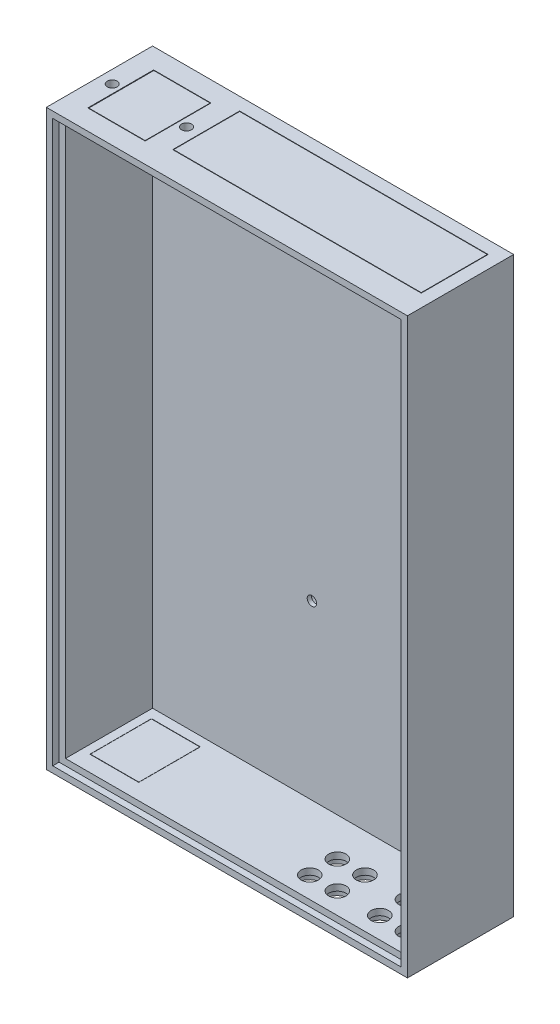
from build123d import *

# Parameters (mm, degrees)
SKETCH1_W           = 170
SKETCH1_H           = 270
BOSS_EXTRUDE1_DEPTH = 50
SKETCH2_W           = 158
SKETCH2_H           = 258
CUT_EXTRUDE1_DEPTH  = 44
SKETCH3_W           = 23
SKETCH3_H           = 29
CUT_EXTRUDE2_DEPTH  = 6
SKETCH4_W           = 28
SKETCH4_H           = 35
CUT_EXTRUDE3_DEPTH  = 4.5
CHAMFER1_SIZE       = 5
CHAMFER2_SIZE       = 5
SKETCH5_W           = 22.8
SKETCH5_H           = 28.7
BOSS_EXTRUDE2_DEPTH = 1.5
SKETCH6_W           = 0.854807692
SKETCH6_H           = 4.7625
CUT_EXTRUDE4_DEPTH  = 0.25
CUT_EXTRUDE5_DEPTH  = 0.25
CUT_EXTRUDE6_DEPTH  = 0.25
SKETCH9_W           = 117
SKETCH9_H           = 31.5
CUT_EXTRUDE7_DEPTH  = 6
SKETCH10_W          = 27
SKETCH10_H          = 31
CUT_EXTRUDE8_DEPTH  = 6
SKETCH11_R          = 2.35
CUT_EXTRUDE9_DEPTH  = 6
SKETCH12_R          = 2.35
CUT_EXTRUDE10_DEPTH = 6
SKETCH13_W          = 116.6
SKETCH13_H          = 31.1
BOSS_EXTRUDE3_DEPTH = 6
SKETCH14_W          = 26.5
SKETCH14_H          = 30.6
BOSS_EXTRUDE4_DEPTH = 6
SKETCH15_R          = 4.1
CUT_EXTRUDE11_DEPTH = 6
SKETCH16_R          = 5.75
CUT_EXTRUDE12_DEPTH = 3
CUT_EXTRUDE13_DEPTH = 0.25
SKETCH18_W          = 2.289663461
SKETCH18_H          = 1.102430555
CUT_EXTRUDE14_DEPTH = 0.25
SKETCH19_R          = 2.2
CUT_EXTRUDE15_DEPTH = 10
SKETCH20_R          = 3.75
CUT_EXTRUDE16_DEPTH = 4
SKETCH21_W          = 164
SKETCH21_H          = 264
CUT_EXTRUDE17_DEPTH = 3


with BuildPart() as part:
    # Sketch1 → Boss-Extrude1 (new body)
    with BuildSketch(Plane.XY):
        with Locations((42.589098532, -74.769392034)):
            Rectangle(SKETCH1_W, SKETCH1_H)
    extrude(amount=BOSS_EXTRUDE1_DEPTH)

    # Sketch2 → Cut-Extrude1 (cut)
    with BuildSketch(Plane.XY.offset(50)):
        with Locations((42.589098532, -74.769392034)):
            Rectangle(SKETCH2_W, SKETCH2_H)
    extrude(amount=-CUT_EXTRUDE1_DEPTH, mode=Mode.SUBTRACT)

    # Sketch3 → Cut-Extrude2 (cut)
    with BuildSketch(Plane.XZ.offset(209.769392034)):
        with Locations((-20.910901468, 25)):
            Rectangle(SKETCH3_W, SKETCH3_H)
    extrude(amount=-CUT_EXTRUDE2_DEPTH, mode=Mode.SUBTRACT)

    # Sketch4 → Cut-Extrude3 (cut)
    with BuildSketch(Plane.XZ.offset(209.769392034)):
        with Locations((-20.910901468, 25)):
            Rectangle(SKETCH4_W, SKETCH4_H)
    extrude(amount=-CUT_EXTRUDE3_DEPTH, mode=Mode.SUBTRACT)

    # Chamfer1
    # the kernel refuses this chamfer: 5 mm, written as the material it takes off along each edge
    with BuildSketch(Plane(origin=(-34.910901468, -209.769392034, 42.5), x_dir=(0, -0.0274958766105877, 0.9996219169112968), z_dir=(1, 0, 0))) as chamfer1_piece_1_section:
        Polygon((CHAMFER1_SIZE * 0.999621916911, -CHAMFER1_SIZE * 0.0274958766106), (-CHAMFER1_SIZE * 0.0274958766106, -CHAMFER1_SIZE * 0.999621916911), (0, 0), align=None)
    chamfer1_piece_1 = extrude(amount=28, mode=Mode.PRIVATE)
    chamfer1_piece_1 = split(chamfer1_piece_1, bisect_by=Plane(origin=(-20.910901468, -205.269392034, 44.179503735), z_dir=(0, -1, 0)), keep=Keep.TOP, mode=Mode.PRIVATE)
    add(chamfer1_piece_1, mode=Mode.SUBTRACT)

    # Chamfer2
    # the kernel refuses this chamfer: 5 mm, written as the material it takes off along each edge
    with BuildSketch(Plane(origin=(-6.910901468, -209.769392034, 7.5), x_dir=(0, 0.9996219169112968, 0.027495876610586282), z_dir=(-1, 0, 0))) as chamfer2_piece_1_section:
        Polygon((CHAMFER2_SIZE * 0.999621916911, CHAMFER2_SIZE * 0.0274958766106), (-CHAMFER2_SIZE * 0.0274958766106, CHAMFER2_SIZE * 0.999621916911), (0, 0), align=None)
    chamfer2_piece_1 = extrude(amount=28, mode=Mode.PRIVATE)
    chamfer2_piece_1 = split(chamfer2_piece_1, bisect_by=Plane(origin=(-20.910901468, -205.269392034, 5.820496265), z_dir=(0, -1, 0)), keep=Keep.TOP, mode=Mode.PRIVATE)
    add(chamfer2_piece_1, mode=Mode.SUBTRACT)

    # Sketch6 → Cut-Extrude4 (cut)
    with BuildSketch(Plane(origin=(0, -81.134696017, -81.134696017), x_dir=(1, 0, 0), z_dir=(0, -0.7071067811865436, -0.7071067811865515))):
        with Locations((-21.390321893, 178.542117658)):
            Rectangle(SKETCH6_W, SKETCH6_H)
    extrude(amount=-CUT_EXTRUDE4_DEPTH, mode=Mode.SUBTRACT)

    # Sketch7 → Cut-Extrude5 (cut)
    with BuildSketch(Plane(origin=(0, -106.134696017, 106.134696017), x_dir=(1, 0, 0), z_dir=(0, -0.7071067811865438, 0.7071067811865513))):
        with BuildLine():
            add(Edge.make_bspline(
                [(-21.393476353, -141.192692767), (-21.358996153, -141.193204636), (-21.291198867, -141.194211105), (-21.191346227, -141.205111993), (-21.095160527, -141.221580195), (-21.002265476, -141.244547593), (-20.913329743, -141.274944127), (-20.827706036, -141.311328257), (-20.746413523, -141.355608406), (-20.668415467, -141.405625108), (-20.593741911, -141.462251105), (-20.524187582, -141.526807666), (-20.458482271, -141.597809341), (-20.398048255, -141.676329548), (-20.341547205, -141.761654063), (-20.289164774, -141.853796415), (-20.241301963, -141.95320758), (-20.197422342, -142.060066953), (-20.158185047, -142.175976309), (-20.125135522, -142.30226518), (-20.096790024, -142.438962405), (-20.072864424, -142.586408245), (-20.054780537, -142.744798691), (-20.042591634, -142.914028515), (-20.034227031, -143.093771467), (-20.03354437, -143.217073656), (-20.033193651, -143.280420632)],
                knots=[0, 0, 0, 0, 0.879237366, 1.728815576, 2.559023295, 3.367336655, 4.166867292, 4.954216142, 5.737608147, 6.525189134, 7.316157332, 8.124696809, 8.942788509, 9.781158001, 10.649253743, 11.551476218, 12.482711956, 13.461909668, 14.496590415, 15.601789533, 16.789733467, 18.056700938, 19.410929216, 20.8549011, 22.384193279, 24, 24, 24, 24], degree=3))
            add(Edge.make_bspline(
                [(-20.033193651, -143.280420632), (-20.033572684, -143.34456015), (-20.034309138, -143.469182083), (-20.042243915, -143.650569056), (-20.055907975, -143.82102759), (-20.073519201, -143.98054005), (-20.097641764, -144.129022201), (-20.125892638, -144.26685851), (-20.15946384, -144.393999017), (-20.199993599, -144.510157245), (-20.243607615, -144.617204287), (-20.291601352, -144.716421623), (-20.343138286, -144.808077991), (-20.397036315, -144.893556151), (-20.456250328, -144.97033625), (-20.51789821, -145.041029213), (-20.584664222, -145.102942254), (-20.653737256, -145.159266095), (-20.727647737, -145.207941196), (-20.805633445, -145.250511637), (-20.88908473, -145.28504132), (-20.976480417, -145.315073395), (-21.069310184, -145.336633184), (-21.166098977, -145.353740168), (-21.267939524, -145.363194537), (-21.33727667, -145.364367413), (-21.37280578, -145.364968408)],
                knots=[0, 0, 0, 0, 1.643780988, 3.193836972, 4.651895693, 6.025988579, 7.305620092, 8.505800249, 9.631074763, 10.672816429, 11.65661981, 12.592235626, 13.49536222, 14.350718032, 15.179365177, 15.97804903, 16.751647189, 17.51006938, 18.259804725, 19.016521909, 19.783502495, 20.571750527, 21.382245291, 22.22305063, 23.089471752, 24, 24, 24, 24], degree=3))
            add(Edge.make_bspline(
                [(-21.37280578, -145.364968408), (-21.408333932, -145.364355821), (-21.477933057, -145.363155771), (-21.580048991, -145.353810465), (-21.677350716, -145.336563883), (-21.770914916, -145.314907875), (-21.860090396, -145.285107769), (-21.945304752, -145.249544982), (-22.025902759, -145.20724016), (-22.102107579, -145.15845165), (-22.173659028, -145.102504659), (-22.241669015, -145.039997602), (-22.305987098, -144.971088918), (-22.36563484, -144.895006774), (-22.421589097, -144.812766706), (-22.473266355, -144.723429575), (-22.520635559, -144.627125451), (-22.565178424, -144.523720098), (-22.603880536, -144.410987316), (-22.638323618, -144.287920417), (-22.666538486, -144.153493535), (-22.68923077, -144.007749858), (-22.707348276, -143.850998149), (-22.720825619, -143.683162749), (-22.728804469, -143.504165484), (-22.7295332, -143.381131747), (-22.729908394, -143.317786667)],
                knots=[0, 0, 0, 0, 0.917216111, 1.796812873, 2.643793957, 3.46689424, 4.273913431, 5.068098542, 5.848489301, 6.620921603, 7.401012384, 8.190319798, 9.003608147, 9.831726257, 10.68377682, 11.569763213, 12.493818149, 13.453288342, 14.474581811, 15.568529029, 16.750744269, 18.018426408, 19.375425659, 20.823733699, 22.36466933, 24, 24, 24, 24], degree=3))
            add(Edge.make_bspline(
                [(-22.729908394, -143.317786667), (-22.729228765, -143.229773666), (-22.727917413, -143.059951445), (-22.711298986, -142.814607712), (-22.686907351, -142.587829931), (-22.651081816, -142.379997444), (-22.606784038, -142.190340502), (-22.550058427, -142.020108464), (-22.485480445, -141.866945789), (-22.430451708, -141.776211298), (-22.40394936, -141.732512729)],
                knots=[0, 0, 0, 0, 1.288568992, 2.486310467, 3.599230591, 4.627010532, 5.572937695, 6.447898582, 7.252493626, 8, 8, 8, 8], degree=3))
            add(Edge.make_bspline(
                [(-22.40394936, -141.732512729), (-22.373133692, -141.689583269), (-22.31288299, -141.605647715), (-22.207532952, -141.495456023), (-22.094348053, -141.401214691), (-21.971003539, -141.325056487), (-21.839450156, -141.264998121), (-21.698558449, -141.222579573), (-21.54884871, -141.197864551), (-21.446040535, -141.194442439), (-21.393476353, -141.192692767)],
                knots=[0, 0, 0, 0, 1.058512271, 2.069600068, 3.047294572, 4.004278952, 4.967380941, 5.939006123, 6.946246673, 8, 8, 8, 8], degree=3))
        make_face()
        with BuildLine():
            add(Edge.make_bspline(
                [(-21.375985868, -141.905032511), (-21.407156255, -141.906509925), (-21.46826676, -141.909406442), (-21.556941013, -141.933993779), (-21.640555298, -141.971970248), (-21.704158451, -142.017668991), (-21.751764779, -142.061476716), (-21.785027661, -142.101121283), (-21.817104469, -142.145361762), (-21.845436321, -142.196194499), (-21.872188984, -142.251793013), (-21.8983344, -142.312409689), (-21.919766776, -142.379533404), (-21.940823518, -142.452021031), (-21.959271188, -142.531876661), (-21.974726291, -142.619753025), (-21.988534067, -142.716221593), (-21.998165156, -142.82134555), (-22.00714422, -142.935014911), (-22.013580839, -143.057482888), (-22.016271828, -143.188716441), (-22.017127212, -143.279095042), (-22.017568651, -143.325736888)],
                knots=[0, 0, 0, 0, 1.076674018, 2.110852608, 3.161083442, 4.239746716, 4.804137807, 5.395870207, 6.026861976, 6.692161227, 7.405688833, 8.16177676, 8.973626916, 9.841385931, 10.773283133, 11.807421078, 12.927755683, 14.143907515, 15.458935494, 16.872852025, 18.386167141, 20, 20, 20, 20], degree=3))
            add(Edge.make_bspline(
                [(-22.017568651, -143.325736888), (-22.016842095, -143.386163654), (-22.015448871, -143.50203646), (-22.008151815, -143.668665588), (-21.993525472, -143.820311513), (-21.975333254, -143.958001994), (-21.94978154, -144.080844071), (-21.92038264, -144.189999946), (-21.884077612, -144.284078144), (-21.842120158, -144.36443925), (-21.795650386, -144.432802275), (-21.745205404, -144.490911155), (-21.692502684, -144.541230703), (-21.635897202, -144.582104651), (-21.575524001, -144.613428562), (-21.511887087, -144.635959463), (-21.44494602, -144.649751567), (-21.399105467, -144.651664088), (-21.375985868, -144.652628665)],
                knots=[0, 0, 0, 0, 1.771748488, 3.397459088, 4.888034009, 6.237357457, 7.467047327, 8.564189669, 9.548206622, 10.417051504, 11.216568818, 11.965764335, 12.669334354, 13.348544111, 14.005342236, 14.656555988, 15.322436492, 16, 16, 16, 16], degree=3))
            add(Edge.make_bspline(
                [(-21.375985868, -144.652628665), (-21.353659661, -144.65196863), (-21.309947724, -144.650676363), (-21.246205931, -144.637411422), (-21.185927161, -144.615845509), (-21.129293416, -144.585339011), (-21.076102125, -144.546545331), (-21.026613254, -144.499293994), (-20.981200038, -144.443114012), (-20.954742092, -144.401420158), (-20.941108815, -144.379936107)],
                knots=[0, 0, 0, 0, 0.992283464, 1.942767638, 2.88273346, 3.832339453, 4.79467288, 5.803907806, 6.868395428, 8, 8, 8, 8], degree=3))
            add(Edge.make_bspline(
                [(-20.941108815, -144.379936107), (-20.925057928, -144.350578838), (-20.891400519, -144.289019025), (-20.852452108, -144.185139137), (-20.819667506, -144.067979792), (-20.791450278, -143.93717638), (-20.772151416, -143.792212995), (-20.755531259, -143.634008863), (-20.747514944, -143.461767332), (-20.746211047, -143.342437778), (-20.745533394, -143.280420632)],
                knots=[0, 0, 0, 0, 0.710965849, 1.490837728, 2.352621235, 3.297892224, 4.334225155, 5.461620853, 6.680770821, 8, 8, 8, 8], degree=3))
            add(Edge.make_bspline(
                [(-20.745533394, -143.280420632), (-20.745795157, -143.217865147), (-20.746299005, -143.097456518), (-20.755543162, -142.924595767), (-20.768416356, -142.766716159), (-20.787246123, -142.624170176), (-20.81147404, -142.496611778), (-20.84133504, -142.384049305), (-20.876538937, -142.286260917), (-20.918286564, -142.203344122), (-20.964524655, -142.132876221), (-21.0136078, -142.072420228), (-21.065743542, -142.020804427), (-21.120844694, -141.977834577), (-21.180186591, -141.945002389), (-21.242635726, -141.921820149), (-21.308320123, -141.907795671), (-21.353126181, -141.905965996), (-21.375985868, -141.905032511)],
                knots=[0, 0, 0, 0, 1.793836731, 3.452829483, 4.963243077, 6.335886805, 7.574563692, 8.684454726, 9.672768357, 10.54971625, 11.340229787, 12.085688095, 12.778991901, 13.440269426, 14.083255152, 14.715733572, 15.344777694, 16, 16, 16, 16], degree=3))
        make_face(mode=Mode.SUBTRACT)
    extrude(amount=-CUT_EXTRUDE5_DEPTH, mode=Mode.SUBTRACT)

    # Sketch8 → Cut-Extrude6 (cut)
    # profile 1 of 5: a face of its own
    with BuildSketch(Plane.XZ.offset(209.769392034)):
        with BuildLine():
            Line((11.632312698, 25.939053153), (10.682526373, 25.939053153))
            add(Edge.make_bspline(
                [(10.682526373, 25.939053153), (10.686628355, 26.010899464), (10.69464338, 26.151282841), (10.726525126, 26.355194192), (10.769245571, 26.547867995), (10.826261676, 26.728630258), (10.897906143, 26.897415296), (10.982335375, 27.054798506), (11.081706347, 27.199951264), (11.193904117, 27.33217356), (11.317023877, 27.450791402), (11.448509539, 27.555965433), (11.590372354, 27.642752396), (11.740020372, 27.714170031), (11.897428111, 27.771229404), (12.064084896, 27.809378212), (12.238547721, 27.835212958), (12.357981652, 27.837473602), (12.418854498, 27.838625802)],
                knots=[0, 0, 0, 0, 1.199038563, 2.342849363, 3.436047546, 4.486744587, 5.497670872, 6.488682221, 7.459191391, 8.424610317, 9.374430501, 10.305433194, 11.225809216, 12.140057399, 13.06607119, 14.010487599, 14.985989317, 16, 16, 16, 16], degree=3))
            add(Edge.make_bspline(
                [(12.418854498, 27.838625802), (12.493575053, 27.836294324), (12.639447088, 27.831742732), (12.851410724, 27.792916142), (13.049361584, 27.727972669), (13.233155778, 27.637229511), (13.401228633, 27.52194984), (13.553552276, 27.3844977), (13.6855202, 27.221989273), (13.797969119, 27.041186268), (13.891400731, 26.849741331), (13.956873713, 26.651779328), (13.999908399, 26.452553367), (14.004498315, 26.318404689), (14.00677851, 26.25176182)],
                knots=[0, 0, 0, 0, 1.075374347, 2.099382735, 3.09057751, 4.06680945, 5.040638231, 6.016817125, 7.011024321, 8.044445721, 9.0776792, 10.070479129, 11.0414456, 12, 12, 12, 12], degree=3))
            add(Edge.make_bspline(
                [(14.00677851, 26.25176182), (14.005890723, 26.211451503), (14.004103826, 26.130316792), (13.991679294, 26.007540061), (13.97304004, 25.882477606), (13.944936589, 25.755236657), (13.909889281, 25.625781545), (13.867371831, 25.493724857), (13.816398004, 25.359815304), (13.75781845, 25.222545759), (13.687932895, 25.081470561), (13.606560879, 24.934474937), (13.511542606, 24.781689284), (13.404025777, 24.622250924), (13.283488207, 24.456411318), (13.149341473, 24.284670024), (13.003130629, 24.106421882), (12.899360681, 23.987273003), (12.846046339, 23.92605736)],
                knots=[0, 0, 0, 0, 0.728284026, 1.46585585, 2.227944881, 3.01186502, 3.81876927, 4.650621989, 5.517437689, 6.406905708, 7.346299482, 8.360816762, 9.441613733, 10.596154504, 11.834900912, 13.145207542, 14.533280747, 16, 16, 16, 16], degree=3))
            Line((12.846046339, 23.92605736), (12.293771031, 23.29321982))
            Line((12.293771031, 23.29321982), (14.07462039, 23.29321982))
            Line((14.07462039, 23.29321982), (14.07462039, 22.411275375))
            Line((14.07462039, 22.411275375), (10.546842613, 22.411275375))
            Line((10.546842613, 22.411275375), (10.546842613, 22.892528714))
            Line((10.546842613, 22.892528714), (12.113566037, 24.559954929))
            add(Edge.make_bspline(
                [(12.113566037, 24.559954929), (12.158926706, 24.608594269), (12.246776871, 24.702794248), (12.371778601, 24.841136938), (12.484894125, 24.972420848), (12.583777901, 25.098043888), (12.67361922, 25.213931357), (12.750412067, 25.323576248), (12.814859035, 25.425987332), (12.88482536, 25.549477214), (12.951270368, 25.696760872), (13.012237686, 25.866437686), (13.049401484, 26.028609642), (13.054531264, 26.134284375), (13.056992185, 26.184979969)],
                knots=[0, 0, 0, 0, 1.246127091, 2.413378631, 3.493388633, 4.492180848, 5.408488754, 6.240484944, 6.999099869, 7.674939598, 8.898438119, 10.020720584, 11.050475521, 12, 12, 12, 12], degree=3))
            add(Edge.make_bspline(
                [(13.056992185, 26.184979969), (13.055152214, 26.234024045), (13.051586974, 26.329054806), (13.012407877, 26.464235556), (12.951710262, 26.586627926), (12.866178749, 26.692574694), (12.762573299, 26.779638178), (12.642847469, 26.844393552), (12.507977378, 26.881757106), (12.413430874, 26.886433688), (12.364793, 26.888839478)],
                knots=[0, 0, 0, 0, 1.062038974, 2.057870785, 3.028805853, 4.01125022, 4.991535629, 5.949134679, 6.94496649, 8, 8, 8, 8], degree=3))
            add(Edge.make_bspline(
                [(12.364793, 26.888839478), (12.339666055, 26.88795075), (12.290199627, 26.886201147), (12.217487846, 26.874554514), (12.148297362, 26.854028538), (12.081858046, 26.82652662), (12.018878958, 26.79007263), (11.959518949, 26.74513728), (11.903152588, 26.692862478), (11.850038392, 26.633411682), (11.801697541, 26.567064575), (11.758761373, 26.494427104), (11.72326031, 26.415544357), (11.692003884, 26.331457706), (11.667897433, 26.241263992), (11.650344946, 26.145503014), (11.637000962, 26.044330563), (11.633903882, 25.974784017), (11.632312698, 25.939053153)],
                knots=[0, 0, 0, 0, 0.903469896, 1.778625579, 2.63899355, 3.493148037, 4.358286772, 5.247621495, 6.164656832, 7.118446693, 8.109501108, 9.111810964, 10.146451449, 11.215617525, 12.33435995, 13.498009769, 14.714554818, 16, 16, 16, 16], degree=3))
        make_face()
    # profile 2 of 5: a face of its own
    with BuildSketch(Plane.XZ.offset(209.769392034)):
        Polygon((16.815856368, 27.838625802), (17.805923809, 27.838625802), (17.805923809, 24.378689905), (18.280816972, 24.378689905), (18.280816972, 23.496745461), (17.805923809, 23.496745461), (17.805923809, 22.411275375), (16.856137484, 22.411275375), (16.856137484, 23.496745461), (14.617355433, 23.496745461), (14.617355433, 24.458192109), align=None)
        Polygon((16.856137484, 24.378689905), (16.856137484, 26.179679822), (15.684805019, 24.378689905), align=None, mode=Mode.SUBTRACT)
    # profile 3 of 5: a face of its own
    with BuildSketch(Plane.XZ.offset(209.769392034)):
        Polygon((18.721789194, 27.702942042), (19.736237311, 27.702942042), (21.096255006, 23.944077859), (22.459452789, 27.702942042), (23.470720818, 27.702942042), (21.552067639, 22.411275375), (20.637262284, 22.411275375), align=None)
    # profile 4 of 5: a face of its own
    with BuildSketch(Plane.XZ.offset(209.769392034)):
        with BuildLine():
            Line((26.354000732, 27.702942042), (27.414030113, 27.702942042))
            add(Edge.make_bspline(
                [(27.414030113, 27.702942042), (27.483291057, 27.702632015), (27.616909937, 27.702033908), (27.809599356, 27.694781071), (27.987364779, 27.681783544), (28.150165365, 27.665720657), (28.297934175, 27.643201114), (28.43085626, 27.617384221), (28.548959204, 27.585931732), (28.653574793, 27.548598063), (28.747463905, 27.504583126), (28.836313288, 27.457704076), (28.918114934, 27.401755583), (28.996997621, 27.342767539), (29.068451488, 27.275104837), (29.136934257, 27.20327053), (29.199545495, 27.124415727), (29.25657532, 27.039494944), (29.308310158, 26.950077155), (29.353509174, 26.856002507), (29.390172084, 26.757122136), (29.420927707, 26.654075687), (29.445630923, 26.54686765), (29.46207417, 26.434838686), (29.47324325, 26.318771025), (29.474228767, 26.239775301), (29.474727228, 26.19982038)],
                knots=[0, 0, 0, 0, 1.698747864, 3.27724071, 4.728299578, 6.070144658, 7.288476769, 8.393259625, 9.389771311, 10.283485332, 11.113357557, 11.931608583, 12.74405601, 13.541433047, 14.344816069, 15.154114104, 15.974336324, 16.810834471, 17.661136416, 18.50621059, 19.367396281, 20.244825668, 21.142564693, 22.063065223, 23.020325768, 24, 24, 24, 24], degree=3))
            add(Edge.make_bspline(
                [(29.474727228, 26.19982038), (29.474006018, 26.155619203), (29.472588751, 26.068758458), (29.458694972, 25.941431263), (29.434960007, 25.82003631), (29.40393965, 25.703549855), (29.360683967, 25.593888357), (29.311266382, 25.48843526), (29.250467076, 25.390147145), (29.18099415, 25.297794545), (29.105121789, 25.210626591), (29.021048786, 25.131160093), (28.930377609, 25.05885333), (28.833633121, 24.992948521), (28.730452115, 24.933578611), (28.620909039, 24.880187665), (28.504255873, 24.83448329), (28.423022118, 24.810580272), (28.381836937, 24.79846154)],
                knots=[0, 0, 0, 0, 1.102006807, 2.165578795, 3.188629044, 4.184801286, 5.166646146, 6.124351954, 7.085497154, 8.042432466, 9.003981491, 9.963833307, 10.922997304, 11.89326795, 12.880200226, 13.889073926, 14.929769137, 16, 16, 16, 16], degree=3))
            add(Edge.make_bspline(
                [(28.381836937, 24.79846154), (28.354710008, 24.791712316), (28.295944344, 24.777091323), (28.19870331, 24.762247346), (28.086643229, 24.748599222), (27.959401737, 24.736870312), (27.816905476, 24.728897386), (27.659292419, 24.722670885), (27.486491139, 24.718143576), (27.366331962, 24.717982927), (27.303787057, 24.717899307)],
                knots=[0, 0, 0, 0, 0.618981996, 1.340914327, 2.176866532, 3.120127938, 4.170906482, 5.338178032, 6.614476169, 8, 8, 8, 8], degree=3))
            Line((27.303787057, 24.717899307), (27.303787057, 22.411275375))
            Line((27.303787057, 22.411275375), (26.354000732, 22.411275375))
            Line((26.354000732, 22.411275375), (26.354000732, 27.702942042))
        make_face()
        with BuildLine():
            Line((27.303787057, 25.667685631), (27.639816371, 25.667685631))
            add(Edge.make_bspline(
                [(27.639816371, 25.667685631), (27.700962209, 25.668073344), (27.813471461, 25.66878674), (27.967119368, 25.67910286), (28.090593782, 25.69485766), (28.188140862, 25.717453687), (28.26516352, 25.751746149), (28.331590741, 25.79141607), (28.388567065, 25.841577597), (28.437900175, 25.898895724), (28.477340509, 25.964757124), (28.504690327, 26.038089373), (28.522456231, 26.117351682), (28.524097077, 26.172513003), (28.524940903, 26.20088041)],
                knots=[0, 0, 0, 0, 1.8619151, 3.425951444, 4.686033666, 5.651700536, 6.461346321, 7.243864085, 7.999046032, 8.762387399, 9.539336099, 10.322741239, 11.137448474, 12, 12, 12, 12], degree=3))
            add(Edge.make_bspline(
                [(28.524940903, 26.20088041), (28.524105757, 26.225664644), (28.522485373, 26.273752016), (28.510581591, 26.343154022), (28.491610385, 26.407851009), (28.464121838, 26.467167302), (28.428585655, 26.521002113), (28.385259858, 26.569334235), (28.334700399, 26.613198742), (28.295665542, 26.636416895), (28.275833999, 26.648212808)],
                knots=[0, 0, 0, 0, 1.102301479, 2.1387299, 3.123554645, 4.094223062, 5.036071848, 5.982632524, 6.975082478, 8, 8, 8, 8], degree=3))
            add(Edge.make_bspline(
                [(28.275833999, 26.648212808), (28.259035537, 26.656708272), (28.223469752, 26.67469491), (28.162897771, 26.695605691), (28.09299863, 26.713246239), (28.013300431, 26.727887723), (27.924121112, 26.739251035), (27.825476586, 26.747941126), (27.717221687, 26.75143575), (27.641936883, 26.752566582), (27.602715342, 26.753155717)],
                knots=[0, 0, 0, 0, 0.656809284, 1.390599849, 2.23162475, 3.173112763, 4.218524733, 5.370385145, 6.63003504, 8, 8, 8, 8], degree=3))
            Line((27.602715342, 26.753155717), (27.303787057, 26.753155717))
            Line((27.303787057, 26.753155717), (27.303787057, 25.667685631))
        make_face(mode=Mode.SUBTRACT)
    # profile 5 of 5: a face of its own
    with BuildSketch(Plane.XZ.offset(209.769392034)):
        with BuildLine():
            Line((33.138188767, 26.995902445), (32.427969082, 26.346104435))
            add(Edge.make_bspline(
                [(32.427969082, 26.346104435), (32.397546316, 26.389018909), (32.339138848, 26.471408715), (32.244466434, 26.581730607), (32.150221515, 26.67584339), (32.055530969, 26.753353906), (31.959555494, 26.81379122), (31.86246169, 26.856581507), (31.764800009, 26.883783697), (31.699186435, 26.887171025), (31.666867987, 26.888839478)],
                knots=[0, 0, 0, 0, 1.299362458, 2.494594718, 3.587462134, 4.587049575, 5.512617175, 6.380583204, 7.202344345, 8, 8, 8, 8], degree=3))
            add(Edge.make_bspline(
                [(31.666867987, 26.888839478), (31.636722265, 26.887782269), (31.578518796, 26.885741078), (31.495545434, 26.865451786), (31.421880501, 26.830435449), (31.357595892, 26.784648641), (31.306672997, 26.729486153), (31.266015014, 26.671634887), (31.243121153, 26.607780173), (31.240107871, 26.563922179), (31.238616117, 26.54220987)],
                knots=[0, 0, 0, 0, 1.185010067, 2.2879431, 3.333075148, 4.379039566, 5.372662701, 6.27520591, 7.14612461, 8, 8, 8, 8], degree=3))
            add(Edge.make_bspline(
                [(31.238616117, 26.54220987), (31.239550923, 26.520184461), (31.241433493, 26.475828346), (31.259616558, 26.410818936), (31.287023628, 26.347297175), (31.313212203, 26.308628457), (31.326598556, 26.288862848)],
                knots=[0, 0, 0, 0, 0.967525499, 1.948461899, 2.951351359, 4, 4, 4, 4], degree=3))
            add(Edge.make_bspline(
                [(31.326598556, 26.288862848), (31.338768198, 26.273499248), (31.366781109, 26.238134268), (31.420195992, 26.182121652), (31.487273868, 26.113501296), (31.570596033, 26.03463285), (31.666703556, 25.942679899), (31.780051145, 25.841257147), (31.907376161, 25.72722365), (31.997875833, 25.647814852), (32.045298475, 25.606203927)],
                knots=[0, 0, 0, 0, 0.473873513, 1.090794244, 1.870441696, 2.795289791, 3.865433203, 5.087734844, 6.473946851, 8, 8, 8, 8], degree=3))
            add(Edge.make_bspline(
                [(32.045298475, 25.606203927), (32.089811447, 25.567680196), (32.174287819, 25.494570157), (32.294480921, 25.390802195), (32.40011064, 25.29744469), (32.492715759, 25.215898738), (32.570892476, 25.145308735), (32.634969445, 25.085337263), (32.685729259, 25.037151855), (32.71458324, 25.008047839), (32.726897367, 24.995627004)],
                knots=[0, 0, 0, 0, 1.543621617, 2.929473131, 4.163658386, 5.240097082, 6.164993805, 6.925417477, 7.541396219, 8, 8, 8, 8], degree=3))
            add(Edge.make_bspline(
                [(32.726897367, 24.995627004), (32.773614596, 24.945068957), (32.863421516, 24.847878636), (32.980138854, 24.697264203), (33.076200998, 24.550233806), (33.150516494, 24.404020828), (33.206642546, 24.256515709), (33.246212156, 24.104100892), (33.269910659, 23.945183739), (33.272541746, 23.836742182), (33.273872527, 23.781893364)],
                knots=[0, 0, 0, 0, 1.206664779, 2.319633467, 3.337109185, 4.282041471, 5.190008762, 6.099243693, 7.03861361, 8, 8, 8, 8], degree=3))
            add(Edge.make_bspline(
                [(33.273872527, 23.781893364), (33.272925311, 23.728449917), (33.271066838, 23.623591886), (33.248304102, 23.470147776), (33.215845777, 23.323295103), (33.165659512, 23.184631832), (33.10449279, 23.051881848), (33.02781147, 22.927112973), (32.937759774, 22.809062495), (32.834546703, 22.699840711), (32.720380791, 22.600729512), (32.597927, 22.512498382), (32.465987916, 22.439652345), (32.325690805, 22.37966883), (32.177110764, 22.333468725), (32.020424799, 22.299322542), (31.855393246, 22.27882854), (31.742542292, 22.276686136), (31.684888486, 22.275591614)],
                knots=[0, 0, 0, 0, 1.043214005, 2.046824704, 3.02475056, 3.976699089, 4.921714032, 5.875962561, 6.831408892, 7.817874052, 8.806269674, 9.781291748, 10.760897367, 11.74438705, 12.757449933, 13.795994037, 14.874007457, 16, 16, 16, 16], degree=3))
            add(Edge.make_bspline(
                [(31.684888486, 22.275591614), (31.639630739, 22.276394517), (31.549994445, 22.277984725), (31.417884099, 22.290967446), (31.290316625, 22.311920176), (31.167435718, 22.341951699), (31.048687777, 22.380005711), (30.934067924, 22.426487228), (30.82436742, 22.482116698), (30.718756217, 22.545750156), (30.617747717, 22.619636984), (30.520064707, 22.702266588), (30.426677467, 22.794909849), (30.337137478, 22.89734767), (30.252017641, 23.009870129), (30.168531679, 23.130910144), (30.090389958, 23.262714052), (30.042118341, 23.35517556), (30.017462271, 23.402402846)],
                knots=[0, 0, 0, 0, 1.016823716, 2.013894106, 2.979844003, 3.91962641, 4.853723003, 5.779685073, 6.695824784, 7.614987388, 8.547259901, 9.504950863, 10.487499108, 11.500346958, 12.559593716, 13.656357062, 14.802919212, 16, 16, 16, 16], degree=3))
            Line((30.017462271, 23.402402846), (30.852765422, 23.903796743))
            add(Edge.make_bspline(
                [(30.852765422, 23.903796743), (30.883606481, 23.850187603), (30.942731427, 23.7474143), (31.042924175, 23.609325342), (31.145566531, 23.491075007), (31.253031493, 23.394753378), (31.364012328, 23.31907251), (31.479045099, 23.264985712), (31.598210626, 23.231506045), (31.67938077, 23.227417404), (31.719869456, 23.225377939)],
                knots=[0, 0, 0, 0, 1.283663364, 2.460892379, 3.537111102, 4.529833553, 5.449777664, 6.316464042, 7.160231139, 8, 8, 8, 8], degree=3))
            add(Edge.make_bspline(
                [(31.719869456, 23.225377939), (31.761052246, 23.227043477), (31.840952857, 23.230274863), (31.955000755, 23.260122202), (32.059564186, 23.306984714), (32.149948044, 23.373851057), (32.226479396, 23.451024979), (32.282963927, 23.536884496), (32.31844789, 23.629782421), (32.322199405, 23.69431543), (32.324086202, 23.726771836)],
                knots=[0, 0, 0, 0, 1.13588714, 2.203786484, 3.234766741, 4.283437687, 5.291419208, 6.222934724, 7.106237994, 8, 8, 8, 8], degree=3))
            add(Edge.make_bspline(
                [(32.324086202, 23.726771836), (32.322343822, 23.75696724), (32.318804344, 23.818306313), (32.292733639, 23.90950765), (32.251977176, 24.000667511), (32.203759405, 24.075439295), (32.154691786, 24.138043684), (32.107772075, 24.192287554), (32.050636278, 24.252217534), (31.983429268, 24.317909012), (31.907039023, 24.389940286), (31.821401195, 24.468304302), (31.725535141, 24.552310768), (31.657776824, 24.609535142), (31.622346753, 24.639457133)],
                knots=[0, 0, 0, 0, 0.916159276, 1.861089862, 2.860218735, 3.940849679, 4.552606315, 5.27541173, 6.11797699, 7.06649574, 8.129236253, 9.306560635, 10.591630461, 12, 12, 12, 12], degree=3))
            add(Edge.make_bspline(
                [(31.622346753, 24.639457133), (31.554992777, 24.696445055), (31.425720111, 24.805822127), (31.243041432, 24.967368619), (31.078431586, 25.118348618), (30.93331232, 25.260628567), (30.805834589, 25.391580885), (30.696861729, 25.512269217), (30.607590856, 25.623624508), (30.513652511, 25.755517399), (30.424392301, 25.916237949), (30.34724615, 26.109603402), (30.297196984, 26.30294432), (30.291589671, 26.432742763), (30.288829792, 26.496628607)],
                knots=[0, 0, 0, 0, 1.345494975, 2.582412109, 3.71882943, 4.751509156, 5.681369928, 6.505683931, 7.230279997, 7.856715994, 8.973648664, 10.023341002, 11.027102913, 12, 12, 12, 12], degree=3))
            add(Edge.make_bspline(
                [(30.288829792, 26.496628607), (30.289977622, 26.541933018), (30.29223897, 26.631187575), (30.312410542, 26.762423396), (30.342557725, 26.889054936), (30.38634009, 27.010620186), (30.443164314, 27.12696688), (30.512175126, 27.238664585), (30.594444134, 27.34468526), (30.687155752, 27.444958621), (30.789300218, 27.536597062), (30.89845456, 27.617477168), (31.014000957, 27.685789682), (31.135232552, 27.742459873), (31.262900568, 27.785837304), (31.39606448, 27.816585389), (31.534915288, 27.834873369), (31.62935861, 27.837359408), (31.67746828, 27.838625802)],
                knots=[0, 0, 0, 0, 1.010766082, 1.991317756, 2.957454644, 3.913069143, 4.869106762, 5.843196583, 6.838735724, 7.860187025, 8.887984031, 9.89767229, 10.887916223, 11.879572884, 12.879850636, 13.892031539, 14.926195476, 16, 16, 16, 16], degree=3))
            add(Edge.make_bspline(
                [(31.67746828, 27.838625802), (31.739816031, 27.836344989), (31.864019382, 27.831801366), (32.047657619, 27.796271717), (32.227027771, 27.740397602), (32.3715676, 27.672991629), (32.486575245, 27.607695432), (32.574717861, 27.547578918), (32.664407718, 27.478712221), (32.756368107, 27.400878323), (32.848890264, 27.312610731), (32.944605035, 27.216010725), (33.042208189, 27.110243455), (33.105634764, 27.034683807), (33.138188767, 26.995902445)],
                knots=[0, 0, 0, 0, 1.282922637, 2.555718331, 3.837320111, 5.142675274, 5.830281639, 6.55870424, 7.337177975, 8.157850921, 9.037902056, 9.96903443, 10.957596896, 12, 12, 12, 12], degree=3))
        make_face()
    extrude(amount=-CUT_EXTRUDE6_DEPTH, mode=Mode.SUBTRACT)

    # Sketch9 → Cut-Extrude7 (cut)
    with BuildSketch(Plane.XZ.offset(-54.230607966)):
        with Locations((63.089098532, 21.75)):
            Rectangle(SKETCH9_W, SKETCH9_H)
    extrude(amount=-CUT_EXTRUDE7_DEPTH, mode=Mode.SUBTRACT)

    # Sketch10 → Cut-Extrude8 (cut)
    with BuildSketch(Plane(origin=(0, 60.230607966, 0), x_dir=(1, 0, 0), z_dir=(0, 1, 0))):
        with Locations((-18.910901468, -25)):
            Rectangle(SKETCH10_W, SKETCH10_H)
    extrude(amount=-CUT_EXTRUDE8_DEPTH, mode=Mode.SUBTRACT)

    # Sketch11 → Cut-Extrude9 (cut)
    with BuildSketch(Plane(origin=(0, 60.230607966, 0), x_dir=(1, 0, 0), z_dir=(0, 1, 0))):
        with Locations(Location((-1.410901468, -25, 0), (0, 0, 270))):
            Circle(SKETCH11_R)
    extrude(amount=-CUT_EXTRUDE9_DEPTH, mode=Mode.SUBTRACT)

    # Sketch12 → Cut-Extrude10 (cut)
    with BuildSketch(Plane(origin=(0, 60.230607966, 0), x_dir=(1, 0, 0), z_dir=(0, 1, 0))):
        with Locations(Location((-36.410901468, -25, 0), (0, 0, 270))):
            Circle(SKETCH12_R)
    extrude(amount=-CUT_EXTRUDE10_DEPTH, mode=Mode.SUBTRACT)

    # Sketch15 → Cut-Extrude11 (cut)
    with BuildSketch(Plane.XZ.offset(209.769392034)):
        with Locations(Location((114.589098532, 37, 0), (0, 0, 270))):
            Circle(SKETCH15_R)
        with Locations(Location((101.589098532, 37, 0), (0, 0, 270))):
            Circle(SKETCH15_R)
        with Locations(Location((81.589098532, 37, 0), (0, 0, 270))):
            Circle(SKETCH15_R)
        with Locations(Location((68.589098532, 37, 0), (0, 0, 270))):
            Circle(SKETCH15_R)
        with Locations(Location((114.589098532, 24, 0), (0, 0, 270))):
            Circle(SKETCH15_R)
        with Locations(Location((101.589098532, 24, 0), (0, 0, 270))):
            Circle(SKETCH15_R)
        with Locations(Location((81.589098532, 24, 0), (0, 0, 270))):
            Circle(SKETCH15_R)
        with Locations(Location((68.589098532, 24, 0), (0, 0, 270))):
            Circle(SKETCH15_R)
    extrude(amount=-CUT_EXTRUDE11_DEPTH, mode=Mode.SUBTRACT)

    # Sketch16 → Cut-Extrude12 (cut)
    with BuildSketch(Plane.XZ.offset(209.769392034)):
        with Locations(Location((114.589098532, 37, 0), (0, 0, 270))):
            Circle(SKETCH16_R)
        with Locations(Location((114.589098532, 24, 0), (0, 0, 270))):
            Circle(SKETCH16_R)
        with Locations(Location((101.589098532, 37, 0), (0, 0, 270))):
            Circle(SKETCH16_R)
        with Locations(Location((101.589098532, 24, 0), (0, 0, 270))):
            Circle(SKETCH16_R)
        with Locations(Location((81.589098532, 37, 0), (0, 0, 270))):
            Circle(SKETCH16_R)
        with Locations(Location((68.589098532, 37, 0), (0, 0, 270))):
            Circle(SKETCH16_R)
        with Locations(Location((81.589098532, 24, 0), (0, 0, 270))):
            Circle(SKETCH16_R)
        with Locations(Location((68.589098532, 24, 0), (0, 0, 270))):
            Circle(SKETCH16_R)
    extrude(amount=-CUT_EXTRUDE12_DEPTH, mode=Mode.SUBTRACT)

    # Sketch17 → Cut-Extrude13 (cut)
    with BuildSketch(Plane.XZ.offset(209.769392034)):
        Polygon((91.179124912, 37.58846879), (91.179124912, 39.199713448), (92.281555467, 39.199713448), (92.281555467, 37.58846879), (93.977602476, 37.58846879), (93.977602476, 36.486038234), (92.281555467, 36.486038234), (92.281555467, 34.874793576), (91.179124912, 34.874793576), (91.179124912, 36.486038234), (89.483077903, 36.486038234), (89.483077903, 37.58846879), align=None)
    extrude(amount=-CUT_EXTRUDE13_DEPTH, mode=Mode.SUBTRACT)

    # Sketch18 → Cut-Extrude14 (cut)
    with BuildSketch(Plane.XZ.offset(209.769392034)):
        with Locations((91.702338998, 24.560282122)):
            Rectangle(SKETCH18_W, SKETCH18_H)
    extrude(amount=-CUT_EXTRUDE14_DEPTH, mode=Mode.SUBTRACT)

    # Sketch19 → Cut-Extrude15 (cut)
    with BuildSketch(Plane.XY.offset(6)):
        with Locations((88.589098532, 27.480607966)):
            Circle(SKETCH19_R)
        with Locations((38.589098532, 27.480607966)):
            Circle(SKETCH19_R)
        with Locations((88.589098532, -122.519392034)):
            Circle(SKETCH19_R)
        with Locations((38.589098532, -122.519392034)):
            Circle(SKETCH19_R)
    extrude(amount=-CUT_EXTRUDE15_DEPTH, mode=Mode.SUBTRACT)

    # Sketch20 → Cut-Extrude16 (cut)
    with BuildSketch(Plane(origin=(0, 0, 0), x_dir=(-1, 0, 0), z_dir=(0, 0, -1))):
        with Locations((-88.589098532, 27.480607966)):
            Circle(SKETCH20_R)
        with Locations((-38.589098532, 27.480607966)):
            Circle(SKETCH20_R)
        with Locations((-38.589098532, -122.519392034)):
            Circle(SKETCH20_R)
        with Locations((-88.589098532, -122.519392034)):
            Circle(SKETCH20_R)
    extrude(amount=-CUT_EXTRUDE16_DEPTH, mode=Mode.SUBTRACT)

    # Sketch21 → Cut-Extrude17 (cut)
    with BuildSketch(Plane.XY.offset(50)):
        with Locations((42.589098532, -74.769392034)):
            Rectangle(SKETCH21_W, SKETCH21_H)
    extrude(amount=-CUT_EXTRUDE17_DEPTH, mode=Mode.SUBTRACT)


with BuildPart() as body_2:
    # Sketch5 → Boss-Extrude2 (new body)
    with BuildSketch(Plane.XZ.offset(205.269392034)):
        with Locations((-20.910901468, 25)):
            Rectangle(SKETCH5_W, SKETCH5_H)
    extrude(amount=-BOSS_EXTRUDE2_DEPTH)


with BuildPart() as body_3:
    # Sketch13 → Boss-Extrude3 (new body)
    with BuildSketch(Plane(origin=(0, 60.230607966, 0), x_dir=(1, 0, 0), z_dir=(0, 1, 0))):
        with Locations((63.089098532, -21.75)):
            Rectangle(SKETCH13_W, SKETCH13_H)
    extrude(amount=-BOSS_EXTRUDE3_DEPTH)


with BuildPart() as body_4:
    # Sketch14 → Boss-Extrude4 (new body)
    with BuildSketch(Plane(origin=(0, 60.230607966, 0), x_dir=(1, 0, 0), z_dir=(0, 1, 0))):
        with Locations((-18.860901468, -25)):
            Rectangle(SKETCH14_W, SKETCH14_H)
    extrude(amount=-BOSS_EXTRUDE4_DEPTH)


solid = Compound([part.part, body_2.part, body_3.part, body_4.part])
